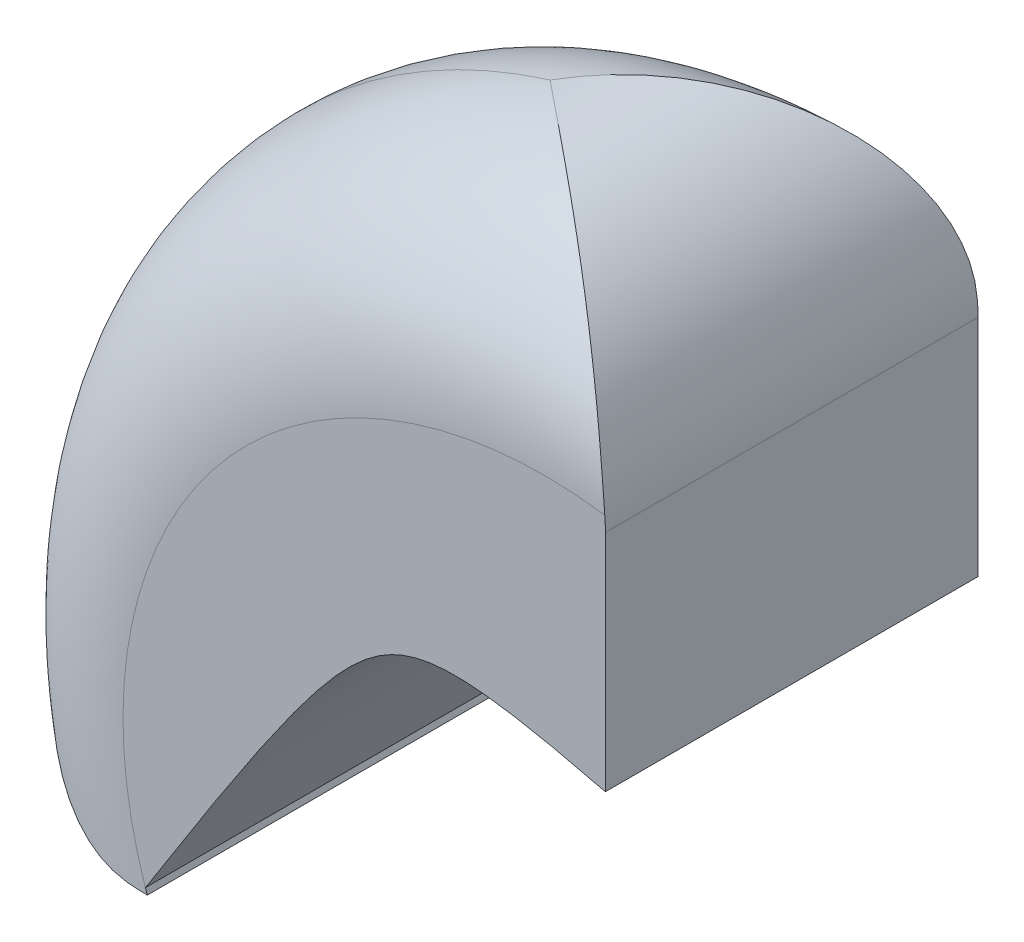
from build123d import *

# Parameters (mm, degrees)
BOSS_EXTRUDE1_DEPTH = 5.08
FILLET1_R           = 2.54
CUT_EXTRUDE1_DEPTH  = 5.08


with BuildPart() as part:
    # Sketch2 → Boss-Extrude1 (new body)
    with BuildSketch(Plane.XY):
        with BuildLine():
            Line((0, 0), (-8.89, 0))
            ThreePointArc((-8.89, 0), (-7.067912046, 7.37504804), (0, 10.16))
            Line((0, 10.16), (0, 0))
        make_face()
    extrude(amount=BOSS_EXTRUDE1_DEPTH)

    # Fillet1
    fillet1_edges = [part.edges().sort_by_distance(p)[0] for p in [
        (-7.067912046, 7.37504804, 0),
        (-8.89, 0, 2.54),
        (0, 10.16, 2.54),
        (-7.067912046, 7.37504804, 5.08),
    ]]
    fillet(fillet1_edges, radius=FILLET1_R - 0.0001)  # a hair under: the kernel refuses the full size

    # Sketch4 → Cut-Extrude1 (cut)
    with BuildSketch(Plane.XY):
        with BuildLine():
            Line((0, 4.342456755), (0, 0))
            Line((0, 0), (-6.244672338, 0))
            Line((-6.244672338, 0), (-6.270779923, 0.075057389))
            add(Edge.make_bspline(
                [(-6.270779923, 0.075057389), (-3.105835382, 5.113383938), (0, 4.342456755)],
                knots=[0, 0, 0, 1, 1, 1], degree=2, weights=[1, 3, 1]))
        make_face()
    extrude(amount=CUT_EXTRUDE1_DEPTH, mode=Mode.SUBTRACT)


solid = part.part
